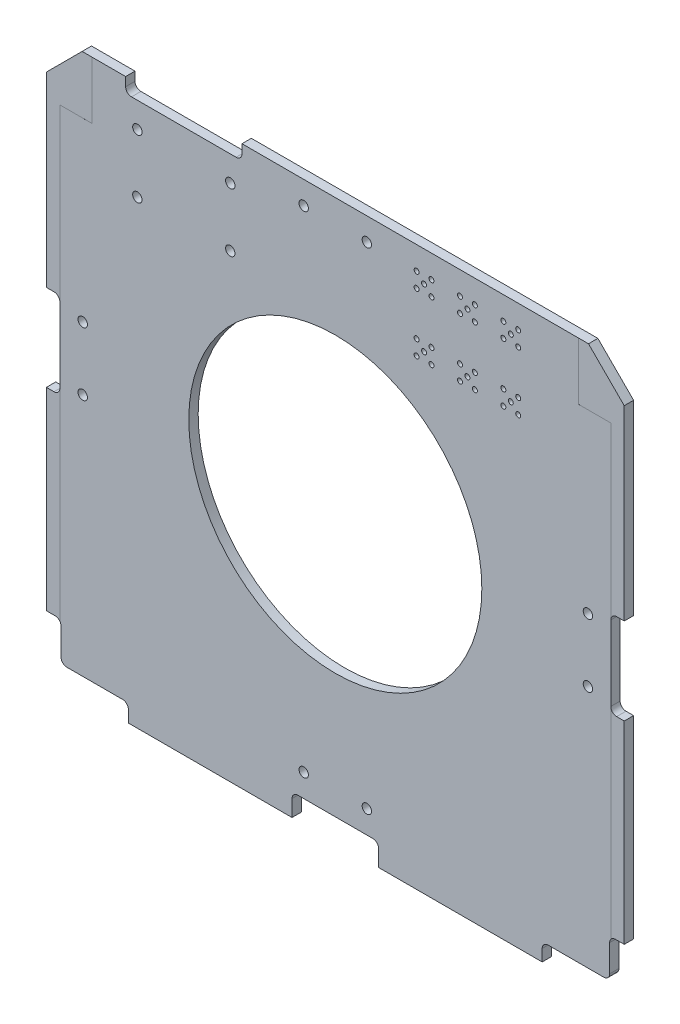
from build123d import *

# Parameters (mm, degrees)
SKETCH1_R                = 0.425
BOSS_EXTRUDE1_DEPTH      = 1.6
LPATTERN2_START          = -0.0125
LPATTERN2_OUTLINE_R      = 0.425
LPATTERN2_DEPTH          = 1.6
SLOTFOOTPRINTS_REF_DEPTH = 0.0001
SLOTFOOTPRINTS_DEPTH     = 0.0001
SKETCH2_R                = 0.8
F_20PIN_MOUNTS_DEPTH     = 71.235674696
SKETCH3_R                = 0.8
F_12PIN_MOUNTS_DEPTH     = 10
SKETCH4_R                = 25
CUT_EXTRUDE1_DEPTH       = 71.235674696


# Read off the part's stored shape, not the designer's step: LPattern2
with BuildPart() as part:
    # Sketch1 → Boss-Extrude1 (new body)
    with BuildSketch(Plane(origin=(0, 0, -0.0125), x_dir=(-1, 0, 0), z_dir=(0, 0, -1))):
        with BuildLine():
            Line((35.3, -50), (35.3, -48))
            ThreePointArc((35.3, -48), (35.592893219, -47.292893219), (36.3, -47))
            Line((36.3, -47), (45.8, -47))
            ThreePointArc((45.8, -47), (46.507106781, -46.707106781), (46.8, -46))
            Line((46.8, -46), (46.8, -41.4))
            ThreePointArc((46.8, -41.4), (47.092893219, -40.692893219), (47.8, -40.4))
            Line((47.8, -40.4), (49.3, -40.4))
            Line((49.3, -40.4), (49.3, 39.2))
            Line((49.3, 39.2), (43.2, 45.3))
            Line((43.2, 45.3), (35.500000002, 45.3))
            Line((35.500000002, 45.3), (3.499999998, 45.3))
            Line((3.499999998, 45.3), (-43.2, 45.3))
            Line((-43.2, 45.3), (-49.3, 39.2))
            Line((-49.3, 39.2), (-49.3, -40.4))
            Line((-49.3, -40.4), (-47.8, -40.4))
            ThreePointArc((-47.8, -40.4), (-47.092893219, -40.692893219), (-46.8, -41.4))
            Line((-46.8, -41.4), (-46.8, -46))
            ThreePointArc((-46.8, -46), (-46.507106781, -46.707106781), (-45.8, -47))
            Line((-45.8, -47), (-36.3, -47))
            ThreePointArc((-36.3, -47), (-35.592893219, -47.292893219), (-35.3, -48))
            Line((-35.3, -48), (-35.3, -50))
            Line((-35.3, -50), (35.3, -50))
        make_face()
        with Locations(Location((-21.27, 41.37, 0), (0, 0, 180))):
            Circle(SKETCH1_R, mode=Mode.SUBTRACT)
        with Locations(Location((-23.81, 41.37, 0), (0, 0, 180))):
            Circle(SKETCH1_R, mode=Mode.SUBTRACT)
        with Locations(Location((-22.54, 40.1, 0), (0, 0, 180))):
            Circle(SKETCH1_R, mode=Mode.SUBTRACT)
        with Locations(Location((-13.87, 41.37, 0), (0, 0, 180))):
            Circle(SKETCH1_R, mode=Mode.SUBTRACT)
        with Locations(Location((-23.81, 38.83, 0), (0, 0, 180))):
            Circle(SKETCH1_R, mode=Mode.SUBTRACT)
        with Locations(Location((-16.41, 41.37, 0), (0, 0, 180))):
            Circle(SKETCH1_R, mode=Mode.SUBTRACT)
        with Locations(Location((-15.14, 40.1, 0), (0, 0, 180))):
            Circle(SKETCH1_R, mode=Mode.SUBTRACT)
        with Locations(Location((-21.27, 38.83, 0), (0, 0, 180))):
            Circle(SKETCH1_R, mode=Mode.SUBTRACT)
        with Locations(Location((-28.67, 41.37, 0), (0, 0, 180))):
            Circle(SKETCH1_R, mode=Mode.SUBTRACT)
        with Locations(Location((-31.21, 41.37, 0), (0, 0, 180))):
            Circle(SKETCH1_R, mode=Mode.SUBTRACT)
        with Locations(Location((-16.41, 38.83, 0), (0, 0, 180))):
            Circle(SKETCH1_R, mode=Mode.SUBTRACT)
        with Locations(Location((-29.94, 40.1, 0), (0, 0, 180))):
            Circle(SKETCH1_R, mode=Mode.SUBTRACT)
        with Locations(Location((-31.21, 38.83, 0), (0, 0, 180))):
            Circle(SKETCH1_R, mode=Mode.SUBTRACT)
        with Locations(Location((-28.67, 38.83, 0), (0, 0, 180))):
            Circle(SKETCH1_R, mode=Mode.SUBTRACT)
        with Locations(Location((-13.87, 38.83, 0), (0, 0, 180))):
            Circle(SKETCH1_R, mode=Mode.SUBTRACT)
    extrude(amount=-BOSS_EXTRUDE1_DEPTH)

    # LPattern2 outline → LPattern2 (cut)
    with BuildSketch(Plane.XY.offset(LPATTERN2_START)):
        with Locations((31.21, 31.37)):
            Circle(LPATTERN2_OUTLINE_R)
        with Locations((31.21, 28.83)):
            Circle(LPATTERN2_OUTLINE_R)
        with Locations((29.94, 30.1)):
            Circle(LPATTERN2_OUTLINE_R)
        with Locations((28.67, 28.83)):
            Circle(LPATTERN2_OUTLINE_R)
        with Locations((28.67, 31.37)):
            Circle(LPATTERN2_OUTLINE_R)
        with Locations((16.41, 31.37)):
            Circle(LPATTERN2_OUTLINE_R)
        with Locations((23.81, 31.37)):
            Circle(LPATTERN2_OUTLINE_R)
        with Locations((23.81, 28.83)):
            Circle(LPATTERN2_OUTLINE_R)
        with Locations((22.54, 30.1)):
            Circle(LPATTERN2_OUTLINE_R)
        with Locations((21.27, 28.83)):
            Circle(LPATTERN2_OUTLINE_R)
        with Locations((21.27, 31.37)):
            Circle(LPATTERN2_OUTLINE_R)
        with Locations((16.41, 28.83)):
            Circle(LPATTERN2_OUTLINE_R)
        with Locations((15.14, 30.1)):
            Circle(LPATTERN2_OUTLINE_R)
        with Locations((13.87, 28.83)):
            Circle(LPATTERN2_OUTLINE_R)
        with Locations((13.87, 31.37)):
            Circle(LPATTERN2_OUTLINE_R)
    extrude(amount=LPATTERN2_DEPTH, mode=Mode.SUBTRACT)

    # thermalContacts_lower → slotFootprints_REF (cut)
    with BuildSketch(Plane(origin=(0, 0, -0.0125), x_dir=(-1, 0, 0), z_dir=(0, 0, -1))):
        Polygon((47, 35.5), (47, -41.5), (59.827263463, -41.5), (59.827263463, 47), (41.5, 47), (41.5, 41.5), (41.5, 35.5), align=None)
        Polygon((-47, 35.5), (-47, -41.5), (-56.192158269, -41.5), (-56.192158269, 47), (-41.5, 47), (-41.5, 41.5), (-41.5, 35.5), align=None)
    extrude(amount=-SLOTFOOTPRINTS_REF_DEPTH, mode=Mode.SUBTRACT)

    # thermalContacts_upper → slotFootprints (cut)
    with BuildSketch(Plane.XY.offset(1.5875)):
        Polygon((-47, 35.5), (-47, -41.5), (-56.192158269, -41.5), (-56.192158269, 47), (-41.5, 47), (-41.5, 41.5), (-41.5, 35.5), align=None)
        Polygon((47, 35.5), (47, -41.5), (59.827263463, -41.5), (59.827263463, 47), (41.5, 47), (41.5, 41.5), (41.5, 35.5), align=None)
    extrude(amount=-SLOTFOOTPRINTS_DEPTH, mode=Mode.SUBTRACT)

    # Sketch2 → 20pin_mounts (cut, through all)
    with BuildSketch(Plane.XY.offset(1.5875)):
        with Locations((-33.775, 38.472296419)):
            Circle(SKETCH2_R)
        with Locations((-17.925, 38.472296419)):
            Circle(SKETCH2_R)
        with Locations((-17.925, 28.472296419)):
            Circle(SKETCH2_R)
        with Locations((-33.775, 28.472296419)):
            Circle(SKETCH2_R)
        with BuildLine():
            Line((-35.775, 45.3), (-35.775, 43.8))
            ThreePointArc((-35.775, 43.8), (-35.482106781, 43.092893219), (-34.775, 42.8))
            Line((-34.775, 42.8), (-16.925, 42.8))
            ThreePointArc((-16.925, 42.8), (-16.217893218, 43.092893219), (-15.925, 43.8))
            Line((-15.925, 43.8), (-15.925, 45.3))
            Line((-15.925, 45.3), (-35.775, 45.3))
        make_face()
    extrude(amount=-F_20PIN_MOUNTS_DEPTH, mode=Mode.SUBTRACT)

    # Sketch3 → 12pin_mounts (cut)
    with BuildSketch(Plane(origin=(0, 0, -0.0125), x_dir=(-1, 0, 0), z_dir=(0, 0, -1))):
        with Locations((5.390000006, 41.4)):
            Circle(SKETCH3_R)
        with Locations((-5.379999994, 41.4)):
            Circle(SKETCH3_R)
        with Locations((43.1, 5.379999994)):
            Circle(SKETCH3_R)
        with Locations((43.1, -5.390000006)):
            Circle(SKETCH3_R)
        with Locations((5.390000006, -42.303202712)):
            Circle(SKETCH3_R)
        with Locations((-5.379999994, -42.303202712)):
            Circle(SKETCH3_R)
        with Locations((-43.1, -5.390000006)):
            Circle(SKETCH3_R)
        with Locations((-43.1, 5.379999994)):
            Circle(SKETCH3_R)
        with BuildLine():
            Line((-49.3, 7.379999994), (-48, 7.379999994))
            ThreePointArc((-48, 7.379999994), (-47.292893219, 7.087106775), (-47, 6.379999994))
            Line((-47, 6.379999994), (-47, -6.390000006))
            ThreePointArc((-47, -6.390000006), (-47.292893219, -7.097106787), (-48, -7.390000006))
            Line((-48, -7.390000006), (-49.3, -7.390000006))
            Line((-49.3, -7.390000006), (-49.3, 7.379999994))
        make_face()
        with BuildLine():
            Line((48, 7.379999994), (49.3, 7.379999994))
            Line((49.3, 7.379999994), (49.3, -7.390000006))
            Line((49.3, -7.390000006), (48, -7.390000006))
            ThreePointArc((48, -7.390000006), (47.292893219, -7.097106787), (47, -6.390000006))
            Line((47, -6.390000006), (47, 6.379999994))
            ThreePointArc((47, 6.379999994), (47.292893219, 7.087106775), (48, 7.379999994))
        make_face()
        with BuildLine():
            Line((-6.379999994, -46.203202712), (6.390000006, -46.203202712))
            ThreePointArc((6.390000006, -46.203202712), (7.097106787, -46.496095931), (7.390000006, -47.203202712))
            Line((7.390000006, -47.203202712), (7.390000006, -50))
            Line((7.390000006, -50), (-7.379999994, -50))
            Line((-7.379999994, -50), (-7.379999994, -47.203202712))
            ThreePointArc((-7.379999994, -47.203202712), (-7.087106775, -46.496095931), (-6.379999994, -46.203202712))
        make_face()
    extrude(amount=-F_12PIN_MOUNTS_DEPTH, mode=Mode.SUBTRACT)

    # Sketch4 → Cut-Extrude1 (cut, through all)
    with BuildSketch(Plane(origin=(0, 0, -0.0125), x_dir=(-1, 0, 0), z_dir=(0, 0, -1))):
        Circle(SKETCH4_R)
    extrude(amount=-CUT_EXTRUDE1_DEPTH, mode=Mode.SUBTRACT)


solid = part.part
